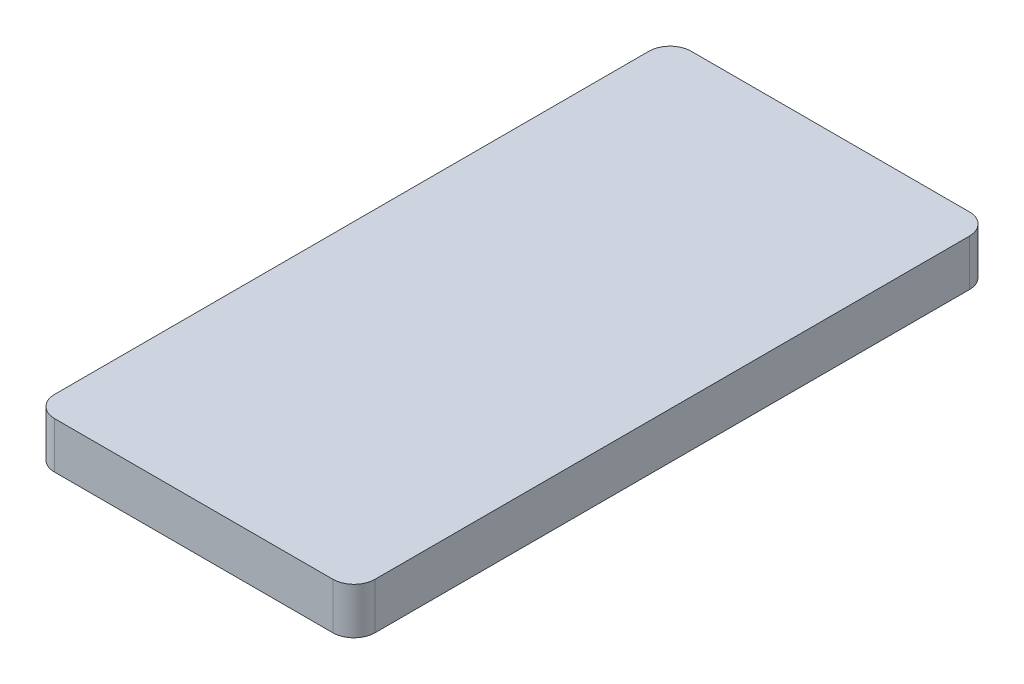
from build123d import *

# Parameters (mm, degrees)
SKETCH_1_W       = 76
SKETCH_1_H       = 151
EXTRUDE_1_DEPTH  = 11
EXTRUDE_START    = -11
EXTRUDE_2_DEPTH  = 12
FILLET_1_R       = 5
WRAP_1_OUTLINE_R = 1
WRAP_1_DEPTH     = 0.01


# Read off the part's stored shape, not the designer's step: 包覆1
with BuildPart() as part:
    # 草图1 → 凸台-拉伸1 (new body)
    with BuildSketch(Plane(origin=(0, 0, 0), x_dir=(1, 0, 0), z_dir=(0, 1, 0))):
        Rectangle(SKETCH_1_W, SKETCH_1_H)
    extrude(amount=EXTRUDE_1_DEPTH)

    # 草图2 → 凸台-拉伸2 (add)
    with BuildSketch(Plane.XZ.offset(EXTRUDE_START)):
        with BuildLine():
            Line((10.145843496, 74.5), (24.854156504, 74.5))
            ThreePointArc((24.854156504, 74.5), (33.442564803, 70.942564803), (37, 62.354156504))
            Line((37, 62.354156504), (37, 47.354156504))
            ThreePointArc((37, 47.354156504), (34.331959922, 39.7585817), (27.5, 35.5))
            Line((27.5, 35.5), (7.5, 35.5))
            ThreePointArc((7.5, 35.5), (0.668040078, 39.7585817), (-2, 47.354156504))
            Line((-2, 47.354156504), (-2, 62.354156504))
            ThreePointArc((-2, 62.354156504), (1.557435197, 70.942564803), (10.145843496, 74.5))
        make_face()
    extrude(amount=EXTRUDE_2_DEPTH)

    # 圆角1
    fillet_1_edges = [part.edges().sort_by_distance(p)[0] for p in [
        (38, 5.5, 75.5),
        (-38, 5.5, 75.5),
        (-38, 5.5, -75.5),
        (38, 5.5, -75.5),
    ]]
    fillet(fillet_1_edges, radius=FILLET_1_R)

    # 包覆1 outline → 包覆1 (add)
    with BuildSketch(Plane.XZ):
        Circle(WRAP_1_OUTLINE_R)
    extrude(amount=WRAP_1_DEPTH)


solid = part.part
